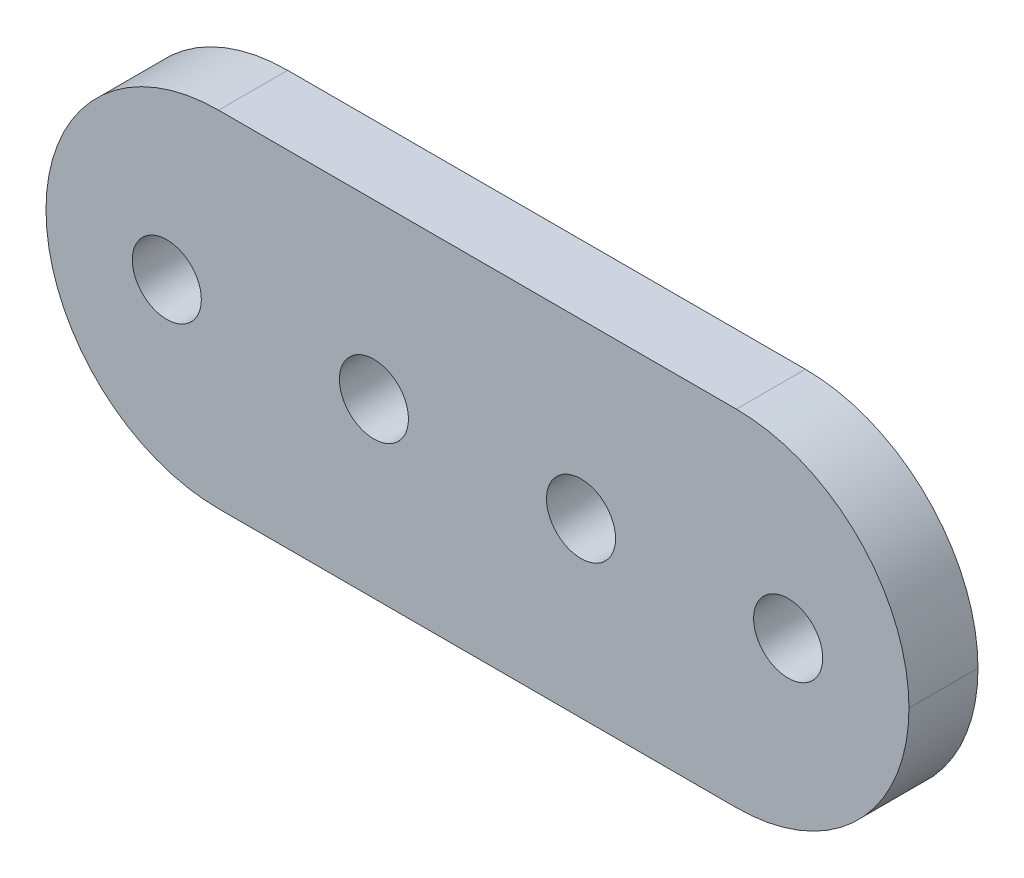
from build123d import *

# Parameters (mm, degrees)
SKETCH_1_W      = 50
SKETCH_1_H      = 20
SKETCH_1_R      = 2
EXTRUDE_1_DEPTH = 4
FILLET_1_R      = 10


with BuildPart() as part:
    # 草图1 → 凸台-拉伸1 (new body)
    with BuildSketch(Plane.XY):
        with Locations((25, -10)):
            Rectangle(SKETCH_1_W, SKETCH_1_H)
        with Locations((7, -10)):
            Circle(SKETCH_1_R, mode=Mode.SUBTRACT)
        with Locations((19, -10)):
            Circle(SKETCH_1_R, mode=Mode.SUBTRACT)
        with Locations((31, -10)):
            Circle(SKETCH_1_R, mode=Mode.SUBTRACT)
        with Locations((43, -10)):
            Circle(SKETCH_1_R, mode=Mode.SUBTRACT)
    extrude(amount=EXTRUDE_1_DEPTH)

    # 圆角1
    fillet_1_edges = [part.edges().sort_by_distance(p)[0] for p in [
        (50, 0, 2),
        (50, -20, 2),
        (0, -20, 2),
        (0, 0, 2),
    ]]
    fillet(fillet_1_edges, radius=FILLET_1_R - 0.0001)  # a hair under: the kernel refuses the full size


solid = part.part
